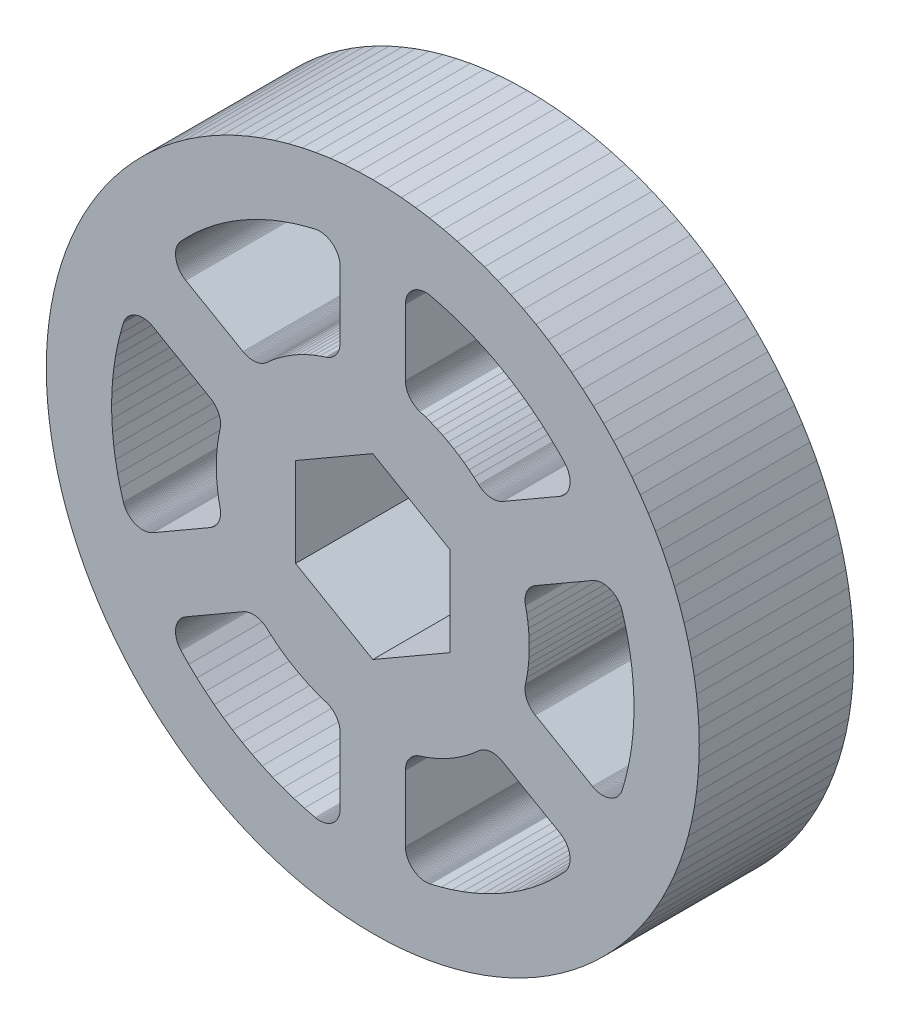
from build123d import *

# Parameters (mm, degrees)
BOSS_EXTRUDE1_DEPTH = 12.699999847


with BuildPart() as part:
    # Sketch1 → Boss-Extrude1 (new body)
    with BuildSketch(Plane.XY.offset(12.699999847)):
        Polygon((19.795958769, 18.139653828), (18.985877629, 18.985877629), (18.139653828, 19.795958769), (17.258901935, 20.568357503), (16.345295583, 21.301604971), (15.400575355, 21.994301224), (14.426539916, 22.645130983), (13.425042081, 23.252855756), (12.39798881, 23.816315812), (11.347336288, 24.334440024), (10.275082048, 24.8062439), (9.183269896, 25.230825646), (8.073976124, 25.607379948), (6.949313452, 25.935190096), (5.811422164, 26.213629952), (4.662468143, 26.44217183), (3.504639175, 26.620378615), (2.340139045, 26.747911642), (1.171184213, 26.824528726), (0, 26.850084163), (-1.171184213, 26.824528726), (-2.340139045, 26.747911642), (-3.504639175, 26.620378615), (-4.662468143, 26.44217183), (-5.811422164, 26.213629952), (-6.949313452, 25.935190096), (-8.073976124, 25.607379948), (-9.183269896, 25.230825646), (-10.275082048, 24.8062439), (-11.347336288, 24.334440024), (-12.39798881, 23.816315812), (-13.425042081, 23.252855756), (-14.426539916, 22.645130983), (-15.400575355, 21.994301224), (-16.345295583, 21.301604971), (-17.258901935, 20.568357503), (-18.139653828, 19.795958769), (-18.985877629, 18.985877629), (-19.795958769, 18.139653828), (-20.568357503, 17.258901935), (-21.301604971, 16.345295583), (-21.994301224, 15.400575355), (-22.645130983, 14.426539916), (-23.252855756, 13.425042081), (-23.816315812, 12.39798881), (-24.334440024, 11.347336288), (-24.8062439, 10.275082048), (-25.230825646, 9.183269896), (-25.607379948, 8.073976124), (-25.935190096, 6.949313452), (-26.213629952, 5.811422164), (-26.44217183, 4.662468143), (-26.620378615, 3.504639175), (-26.747911642, 2.340139045), (-26.824528726, 1.171184213), (-26.850084163, 0), (-26.824528726, -1.171184213), (-26.747911642, -2.340139045), (-26.620378615, -3.504639175), (-26.44217183, -4.662468143), (-26.213629952, -5.811422164), (-25.935190096, -6.949313452), (-25.607379948, -8.073976124), (-25.230825646, -9.183269896), (-24.8062439, -10.275082048), (-24.334440024, -11.347336288), (-23.816315812, -12.39798881), (-23.252855756, -13.425042081), (-22.645130983, -14.426539916), (-21.994301224, -15.400575355), (-21.301604971, -16.345295583), (-20.568357503, -17.258901935), (-19.795958769, -18.139653828), (-18.985877629, -18.985877629), (-18.139653828, -19.795958769), (-17.258901935, -20.568357503), (-16.345295583, -21.301604971), (-15.400575355, -21.994301224), (-14.426539916, -22.645130983), (-13.425042081, -23.252855756), (-12.39798881, -23.816315812), (-11.347336288, -24.334440024), (-10.275082048, -24.8062439), (-9.183269896, -25.230825646), (-8.073976124, -25.607379948), (-6.949313452, -25.935190096), (-5.811422164, -26.213629952), (-4.662468143, -26.44217183), (-3.504639175, -26.620378615), (-2.340139045, -26.747911642), (-1.171184213, -26.824528726), (0, -26.850084163), (1.171184213, -26.824528726), (2.340139045, -26.747911642), (3.504639175, -26.620378615), (4.662468143, -26.44217183), (5.811422164, -26.213629952), (6.949313452, -25.935190096), (8.073976124, -25.607379948), (9.183269896, -25.230825646), (10.275082048, -24.8062439), (11.347336288, -24.334440024), (12.39798881, -23.816315812), (13.425042081, -23.252855756), (14.426539916, -22.645130983), (15.400575355, -21.994301224), (16.345295583, -21.301604971), (17.258901935, -20.568357503), (18.139653828, -19.795958769), (18.985877629, -18.985877629), (19.795958769, -18.139653828), (20.568357503, -17.258901935), (21.301604971, -16.345295583), (21.994301224, -15.400575355), (22.645130983, -14.426539916), (23.252855756, -13.425042081), (23.816315812, -12.39798881), (24.334440024, -11.347336288), (24.8062439, -10.275082048), (25.230825646, -9.183269896), (25.607379948, -8.073976124), (25.935190096, -6.949313452), (26.213629952, -5.811422164), (26.44217183, -4.662468143), (26.620378615, -3.504639175), (26.747911642, -2.340139045), (26.824528726, -1.171184213), (26.850084163, 0), (26.824528726, 1.171184213), (26.747911642, 2.340139045), (26.620378615, 3.504639175), (26.44217183, 4.662468143), (26.213629952, 5.811422164), (25.935190096, 6.949313452), (25.607379948, 8.073976124), (25.230825646, 9.183269896), (24.8062439, 10.275082048), (24.334440024, 11.347336288), (23.816315812, 12.39798881), (23.252855756, 13.425042081), (22.645130983, 14.426539916), (21.994301224, 15.400575355), (21.301604971, 16.345295583), (20.568357503, 17.258901935), align=None)
        Polygon((13.769513346, 16.486170008), (14.466463588, 15.878121337), (15.136591353, 15.240634395), (15.778654213, 14.574888602), (15.826125419, 14.521243648), (15.871263381, 14.465621835), (15.913987368, 14.40812358), (15.954217638, 14.348855209), (15.991883307, 14.287924032), (16.026913491, 14.225440311), (16.059245184, 14.161518248), (16.088819315, 14.096275981), (16.115581738, 14.029829681), (16.139485198, 13.962302409), (16.160484406, 13.893816242), (16.178541953, 13.824497196), (16.193624366, 13.754469315), (16.205705064, 13.683862553), (16.214761404, 13.612803909), (16.220776648, 13.541424321), (16.223739968, 13.469852757), (16.223645495, 13.398219154), (16.220495128, 13.326655465), (16.214294804, 13.255291629), (16.205052402, 13.184256612), (16.192788594, 13.113681353), (16.177523071, 13.043693835), (16.159284383, 12.974422042), (16.138106002, 12.905991005), (16.114027309, 12.838525754), (16.087090636, 12.772150336), (16.057346193, 12.706984857), (16.024848126, 12.643147457), (15.989654521, 12.580756276), (15.951831339, 12.51992256), (15.911445524, 12.460759527), (15.868571898, 12.403373501), (15.823288237, 12.347869823), (15.775677237, 12.294348911), (15.725825533, 12.24290823), (15.673824684, 12.193642291), (15.619767232, 12.146640682), (15.563754579, 12.101988071), (15.505886159, 12.059767154), (15.446269281, 12.020054723), (15.38501224, 11.982921659), (10.675257208, 9.263743323), (10.613190542, 9.229635084), (10.549740051, 9.198176635), (10.48501858, 9.169421601), (10.419142301, 9.143424128), (10.352227383, 9.120229503), (10.28439295, 9.09987809), (10.215761078, 9.0824073), (10.146452861, 9.067847652), (10.076591359, 9.056225727), (10.006302588, 9.047561215), (9.935711577, 9.041870853), (9.864940405, 9.039163501), (9.794120009, 9.039445065), (9.723374433, 9.042713578), (9.652829694, 9.0489651), (9.582611806, 9.058186834), (9.5128458, 9.070363028), (9.443654737, 9.085473007), (9.375163648, 9.103488221), (9.30749264, 9.124377167), (9.240763791, 9.148102433), (9.175096224, 9.174622671), (9.110605125, 9.203889641), (9.047406663, 9.235852149), (8.985613071, 9.270452111), (8.925334612, 9.307629472), (8.86667761, 9.347316302), (8.809748392, 9.389442703), (8.75464639, 9.433933853), (8.701471038, 9.480710008), (8.317225887, 9.819532681), (7.919798884, 10.142792507), (7.509820596, 10.449977553), (7.087940787, 10.740603449), (6.654827435, 11.014206497), (6.211167716, 11.270353523), (5.757664064, 11.508638916), (5.295035651, 11.728685615), (4.824015922, 11.930144125), (4.345350631, 12.112695473), (3.85979882, 12.2760512), (3.792701771, 12.298714199), (3.726620717, 12.324187923), (3.661673306, 12.352427083), (3.597975215, 12.383381472), (3.535639906, 12.416995958), (3.474778382, 12.453210486), (3.415498935, 12.491961065), (3.3579074, 12.533177795), (3.302106163, 12.57678881), (3.248194904, 12.622714364), (3.196269118, 12.67087373), (3.146421841, 12.721182242), (3.09874143, 12.773548341), (3.053313044, 12.827879486), (3.010217411, 12.884079196), (2.969531321, 12.942047053), (2.931327382, 13.001679686), (2.895673522, 13.062871754), (2.862633487, 13.125512993), (2.832265855, 13.189493142), (2.804624527, 13.254697997), (2.77975922, 13.321010407), (2.757713743, 13.38831223), (2.738527968, 13.456484344), (2.722235368, 13.525406641), (2.708865478, 13.594955074), (2.69844168, 13.665004614), (2.690982925, 13.735432198), (2.686502503, 13.806110828), (2.685008044, 13.876916457), (2.685008044, 19.315273358), (2.68653696, 19.386889224), (2.691120753, 19.458375137), (2.698751057, 19.529601145), (2.709414333, 19.600435324), (2.723090645, 19.670751661), (2.739755629, 19.740420203), (2.759378272, 19.809312965), (2.781923379, 19.877305901), (2.807349354, 19.944272997), (2.83561042, 20.010096114), (2.86665489, 20.074653174), (2.900425909, 20.137826039), (2.936862194, 20.199500508), (2.975897291, 20.259562379), (3.017460316, 20.317905328), (3.061474973, 20.37442106), (3.107861761, 20.429005219), (3.156535525, 20.481561325), (3.20740815, 20.531990929), (3.260386357, 20.580207396), (3.315374158, 20.626116214), (3.372270888, 20.669636655), (3.430973176, 20.71068996), (3.491373959, 20.749199339), (3.553363218, 20.785097845), (3.616827985, 20.818316565), (3.681652581, 20.848798397), (3.747718867, 20.876484274), (3.814906736, 20.901324969), (3.883093371, 20.923277165), (3.952154727, 20.942299514), (4.021965035, 20.958356574), (4.092396804, 20.971418811), (4.163322049, 20.981464564), (4.234611556, 20.988474145), (4.30613488, 20.992433771), (4.377762068, 20.993339503), (4.449363166, 20.991187404), (4.520806746, 20.985979443), (4.591962855, 20.977729403), (4.662702523, 20.966449096), (4.732895799, 20.952160184), (5.630479547, 20.728989692), (6.517624238, 20.467386613), (7.392684293, 20.167833347), (8.254037762, 19.830889085), (9.1000878, 19.457176027), (9.929265126, 19.047389222), (10.740033441, 18.602282792), (11.530888442, 18.122691586), (12.30036422, 17.60949574), (13.047034248, 17.063652179), align=None, mode=Mode.SUBTRACT)
        Polygon((16.193624366, -13.754468214), (16.178541953, -13.824496095), (16.160484406, -13.893815142), (16.139485198, -13.962301308), (16.115581738, -14.02982858), (16.088819315, -14.09627488), (16.059245184, -14.161517147), (16.026913491, -14.22543921), (15.991883307, -14.287922931), (15.954217638, -14.348854108), (15.913987368, -14.408122479), (15.871263381, -14.465620734), (15.826125419, -14.521242547), (15.778654213, -14.574887501), (15.136591353, -15.240633294), (14.466463588, -15.878120236), (13.769513346, -16.486168907), (13.047034248, -17.063651078), (12.30036422, -17.609494639), (11.530888442, -18.122690486), (10.740033441, -18.602281691), (9.929265126, -19.047388121), (9.1000878, -19.457174926), (8.254037762, -19.830887985), (7.392684293, -20.167832246), (6.517624238, -20.467385512), (5.630479547, -20.728988592), (4.732895799, -20.952159083), (4.662702523, -20.966447996), (4.591962855, -20.977728302), (4.520806746, -20.985978342), (4.449363166, -20.991186304), (4.377762068, -20.993338403), (4.30613488, -20.99243267), (4.234611556, -20.988473045), (4.163322049, -20.981463463), (4.092396804, -20.97141771), (4.021965035, -20.958355474), (3.952154727, -20.942298414), (3.883093371, -20.923276065), (3.814906736, -20.901323868), (3.747718867, -20.876483173), (3.681652581, -20.848797297), (3.616827985, -20.818315464), (3.553363218, -20.785096744), (3.491373959, -20.749198238), (3.430973176, -20.710688859), (3.372270888, -20.669635554), (3.315374158, -20.626115113), (3.260386357, -20.580206295), (3.20740815, -20.531989828), (3.156535525, -20.481560224), (3.107861761, -20.429004118), (3.061474973, -20.374419959), (3.017460316, -20.317904227), (2.975897291, -20.259561278), (2.936862194, -20.199499407), (2.900425909, -20.137824939), (2.86665489, -20.074652074), (2.83561042, -20.010095013), (2.807349354, -19.944271896), (2.781923379, -19.8773048), (2.759378272, -19.809311864), (2.739755629, -19.740419102), (2.723090645, -19.670750561), (2.709414333, -19.600434224), (2.698751057, -19.529600044), (2.691120753, -19.458374037), (2.68653696, -19.386888124), (2.685008044, -19.315272257), (2.685008044, -13.876915357), (2.686502508, -13.806109727), (2.690982936, -13.735431098), (2.698441697, -13.665003514), (2.708865501, -13.594953975), (2.722235396, -13.525405543), (2.738528002, -13.456483247), (2.757713782, -13.388311135), (2.779759264, -13.321009313), (2.804624577, -13.254696906), (2.83226591, -13.189492053), (2.862633547, -13.125511907), (2.895673587, -13.06287067), (2.931327452, -13.001678605), (2.969531396, -12.942045975), (3.01021749, -12.884078121), (3.053313128, -12.827878415), (3.098741518, -12.773547274), (3.146421934, -12.721181178), (3.196269215, -12.67087267), (3.248195004, -12.622713308), (3.302106267, -12.576787758), (3.357907508, -12.533176748), (3.415499046, -12.491960022), (3.474778496, -12.453209448), (3.535640023, -12.416994925), (3.597975334, -12.383380445), (3.661673428, -12.352426061), (3.726620842, -12.324186905), (3.792701897, -12.298713187), (3.859798948, -12.276050193), (4.345350772, -12.112694505), (4.824016078, -11.930143196), (5.295035823, -11.728684723), (5.757664254, -11.508638061), (6.211167925, -11.270352705), (6.654827665, -11.014205714), (7.087941038, -10.7406027), (7.50982087, -10.449976839), (7.919799183, -10.142791826), (8.317226212, -9.819532031), (8.70147139, -9.48070939), (8.754646746, -9.433933239), (8.809748751, -9.389442093), (8.866677973, -9.347315697), (8.925334978, -9.307628871), (8.98561344, -9.270451515), (9.047407035, -9.235851558), (9.110605499, -9.203889055), (9.175096601, -9.17462209), (9.24076417, -9.148101857), (9.307493021, -9.124376596), (9.37516403, -9.103487656), (9.443655121, -9.085472448), (9.512846185, -9.070362474), (9.582612192, -9.058186286), (9.652830081, -9.048964558), (9.72337482, -9.042713041), (9.794120396, -9.039444534), (9.864940793, -9.039162975), (9.935711965, -9.041870333), (10.006302974, -9.047560701), (10.076591745, -9.056225218), (10.146453246, -9.067847149), (10.215761462, -9.082406802), (10.284393332, -9.099877598), (10.352227764, -9.120229016), (10.41914268, -9.143423647), (10.485018957, -9.169421125), (10.549740425, -9.198176164), (10.613190915, -9.229634618), (10.675257208, -9.263743323), (15.38501224, -11.982921659), (15.446269281, -12.020054723), (15.505886159, -12.059767154), (15.563754579, -12.101988071), (15.619767232, -12.146640682), (15.673824684, -12.193642291), (15.725825533, -12.24290823), (15.775677237, -12.294348911), (15.823288237, -12.347869823), (15.868571898, -12.403373501), (15.911445524, -12.460759527), (15.951831339, -12.51992256), (15.989654521, -12.580756276), (16.024848126, -12.643147457), (16.057346193, -12.706984857), (16.087090636, -12.772150336), (16.114027309, -12.838525754), (16.138106002, -12.905991005), (16.159284383, -12.974422042), (16.177523071, -13.043693835), (16.192788594, -13.113681353), (16.205052402, -13.184256612), (16.214294804, -13.255291629), (16.220495128, -13.326655465), (16.223645495, -13.398219154), (16.223740001, -13.469852741), (16.220776648, -13.54142322), (16.214761404, -13.612802808), (16.205705064, -13.683861452), align=None, mode=Mode.SUBTRACT)
        Polygon((21.162199959, -3.681661617), (20.984089727, -4.589261846), (20.767072381, -5.488353361), (20.511551563, -6.377269173), (20.488829499, -6.44520255), (20.463228782, -6.512104671), (20.434796666, -6.577853461), (20.403582376, -6.642328811), (20.369646952, -6.705413075), (20.333049461, -6.766992051), (20.29385882, -6.826953014), (20.252143941, -6.885186688), (20.207981616, -6.941586745), (20.161452572, -6.9960508), (20.112641476, -7.048479911), (20.061636933, -7.09877809), (20.008533453, -7.146853778), (19.953425548, -7.192619357), (19.896415605, -7.235991145), (19.837606011, -7.276890874), (19.777105059, -7.315243231), (19.715023014, -7.350978808), (19.651472107, -7.384032139), (19.586566539, -7.414343167), (19.520428387, -7.441857255), (19.45317579, -7.466523208), (19.384932794, -7.488296725), (19.315821477, -7.507137933), (19.245967852, -7.523012868), (19.175503843, -7.535891994), (19.104553494, -7.545752669), (19.033246759, -7.552575695), (18.961711621, -7.556349749), (18.890081972, -7.55706745), (18.818487765, -7.554727811), (18.747058952, -7.549334771), (18.675923517, -7.540898175), (18.605213383, -7.529433282), (18.535058501, -7.514961752), (18.465582919, -7.497508688), (18.396916588, -7.477107071), (18.329183556, -7.45379382), (18.262507867, -7.427610776), (18.19700963, -7.398606178), (18.132808953, -7.366832698), (18.070022006, -7.332348419), (13.360266544, -4.613170337), (13.299694357, -4.576477548), (13.240725271, -4.537257367), (13.18346231, -4.495584324), (13.128008845, -4.451531765), (13.074464309, -4.405179926), (13.022922229, -4.356609042), (12.973476132, -4.305907226), (12.926213638, -4.253164067), (12.881217444, -4.198474075), (12.838569262, -4.14193373), (12.798344899, -4.083644683), (12.760616223, -4.023710057), (12.725449194, -3.962237163), (12.692907805, -3.899335033), (12.663049155, -3.8351159), (12.635926408, -3.769694209), (12.611587804, -3.703186379), (12.590077644, -3.635711039), (12.571434324, -3.567388051), (12.555689348, -3.498339494), (12.54287225, -3.428687443), (12.53300469, -3.358557421), (12.526105372, -3.288072736), (12.52218611, -3.217360387), (12.521254781, -3.146545405), (12.523311384, -3.075754051), (12.528352966, -3.005112585), (12.536370667, -2.934746778), (12.547349719, -2.864781904), (12.561271416, -2.795342749), (12.662577584, -2.293164842), (12.743815872, -1.78735293), (12.804858297, -1.278708389), (12.845607394, -0.768037271), (12.865996217, -0.256148938), (12.865996217, 0.25614533), (12.845607435, 0.768033665), (12.804858379, 1.278704786), (12.743815994, 1.787349332), (12.662577747, 2.29316125), (12.561271619, 2.795339166), (12.547349928, 2.864778322), (12.536370881, 2.934743196), (12.528353186, 3.005109004), (12.52331161, 3.07575047), (12.521255012, 3.146541824), (12.522186347, 3.217356806), (12.526105614, 3.288069155), (12.533004938, 3.358553839), (12.542872504, 3.42868386), (12.555689608, 3.498335911), (12.571434589, 3.567384467), (12.590077915, 3.635707453), (12.61158808, 3.703182791), (12.635926689, 3.76969062), (12.663049442, 3.835112308), (12.692908096, 3.899331439), (12.725449491, 3.962233566), (12.760616525, 4.023706457), (12.798345206, 4.08364108), (12.838569573, 4.141930125), (12.88121776, 4.198470465), (12.926213958, 4.253160454), (12.973476457, 4.30590361), (13.022922558, 4.356605422), (13.074464641, 4.405176301), (13.128009181, 4.451528137), (13.18346265, 4.495580691), (13.240725614, 4.537253729), (13.299694703, 4.576473906), (13.360266544, 4.613170338), (18.070022006, 7.332348419), (18.132808953, 7.366832698), (18.19700963, 7.398606178), (18.262507867, 7.427610776), (18.329183556, 7.45379382), (18.396916588, 7.477107071), (18.465582919, 7.497508688), (18.535058501, 7.514961752), (18.605213383, 7.529433282), (18.675923517, 7.540898175), (18.747058952, 7.549334771), (18.818487765, 7.554727811), (18.890081972, 7.55706745), (18.961711621, 7.556349749), (19.033246759, 7.552575695), (19.104553494, 7.545752669), (19.175503843, 7.535891994), (19.245967852, 7.523012868), (19.315821477, 7.507137933), (19.384932794, 7.488296725), (19.45317579, 7.466523208), (19.520428387, 7.441857255), (19.586566539, 7.414343167), (19.651472107, 7.384032139), (19.715023014, 7.350978808), (19.777105059, 7.315243231), (19.837606011, 7.276890874), (19.896415605, 7.235991145), (19.953425548, 7.192619357), (20.008533453, 7.146853778), (20.061636933, 7.09877809), (20.112641476, 7.048479911), (20.161452572, 6.9960508), (20.207981616, 6.941586745), (20.252143941, 6.885186688), (20.29385882, 6.826953014), (20.333049461, 6.766992051), (20.369646952, 6.705413075), (20.403582376, 6.642328811), (20.434796666, 6.577853461), (20.463228782, 6.512104671), (20.488829499, 6.44520255), (20.511551563, 6.377269173), (20.767072381, 5.488353361), (20.984089727, 4.589261846), (21.162199959, 3.681661617), (21.301074257, 2.767234927), (21.400452716, 1.847677807), (21.460156159, 0.924694905), (21.480068414, -2.486e-06), (21.460156159, -0.924694905), (21.400452716, -1.847677807), (21.301074257, -2.767234927), align=None, mode=Mode.SUBTRACT)
        Polygon((-2.685008465, -13.876915907), (-2.685008465, -19.315272808), (-2.686537381, -19.386888674), (-2.691121175, -19.458374587), (-2.698751478, -19.529600594), (-2.709414754, -19.600434774), (-2.723091067, -19.670751111), (-2.73975605, -19.740419652), (-2.759378693, -19.809312414), (-2.7819238, -19.877305351), (-2.807349775, -19.944272447), (-2.835610841, -20.010095564), (-2.866655311, -20.074652624), (-2.90042633, -20.137825489), (-2.936862615, -20.199499958), (-2.975897712, -20.259561829), (-3.017460738, -20.317904777), (-3.061475394, -20.374420509), (-3.107862183, -20.429004668), (-3.156535946, -20.481560775), (-3.207408571, -20.531990379), (-3.260386778, -20.580206846), (-3.315374579, -20.626115664), (-3.372271309, -20.669636105), (-3.430973597, -20.71068941), (-3.49137438, -20.749198788), (-3.55336364, -20.785097294), (-3.616828406, -20.818316014), (-3.681653002, -20.848797847), (-3.747719289, -20.876483723), (-3.814907157, -20.901324418), (-3.883093792, -20.923276615), (-3.952155148, -20.942298964), (-4.021965457, -20.958356024), (-4.092397225, -20.97141826), (-4.16332247, -20.981464014), (-4.234611977, -20.988473595), (-4.306135301, -20.992433221), (-4.377762489, -20.993338953), (-4.449363587, -20.991186854), (-4.520807167, -20.985978893), (-4.591963276, -20.977728852), (-4.662702944, -20.966448546), (-4.73289622, -20.952159633), (-5.630479969, -20.728989142), (-6.51762466, -20.467386063), (-7.392684715, -20.167832797), (-8.254038184, -19.830888535), (-9.100088221, -19.457175476), (-9.929265547, -19.047388672), (-10.740033862, -18.602282242), (-11.530888863, -18.122691036), (-12.300364642, -17.60949519), (-13.04703467, -17.063651629), (-13.769513767, -16.486169457), (-14.466464009, -15.878120787), (-15.136591774, -15.240633844), (-15.778654634, -14.574888052), (-15.826125841, -14.521243098), (-15.871263802, -14.465621284), (-15.913987789, -14.40812303), (-15.954218059, -14.348854659), (-15.991883728, -14.287923481), (-16.026913912, -14.225439761), (-16.059245605, -14.161517697), (-16.088819737, -14.096275431), (-16.11558216, -14.029829131), (-16.139485619, -13.962301859), (-16.160484827, -13.893815692), (-16.178542374, -13.824496645), (-16.193624788, -13.754468764), (-16.205705486, -13.683862002), (-16.214761825, -13.612803359), (-16.220777069, -13.541423771), (-16.22374039, -13.469852207), (-16.223645878, -13.39821862), (-16.220495505, -13.326654932), (-16.214295176, -13.255291096), (-16.205052768, -13.18425608), (-16.192788954, -13.113680821), (-16.177523425, -13.043693305), (-16.159284732, -12.974421513), (-16.138106346, -12.905990478), (-16.114027647, -12.838525229), (-16.087090969, -12.772149813), (-16.057346521, -12.706984336), (-16.024848449, -12.643146939), (-15.989654839, -12.580755761), (-15.951831651, -12.519922048), (-15.911445831, -12.460759018), (-15.868572201, -12.403372995), (-15.823288535, -12.347869321), (-15.775677531, -12.294348413), (-15.725825824, -12.242907736), (-15.673824971, -12.193641801), (-15.619767515, -12.146640197), (-15.563754858, -12.10198759), (-15.505886434, -12.059766678), (-15.446269554, -12.020054251), (-15.385012509, -11.982921192), (-10.67525726, -9.263743234), (-10.613190964, -9.229634533), (-10.549740472, -9.198176085), (-10.485019001, -9.169421051), (-10.419142722, -9.143423578), (-10.352227804, -9.120228953), (-10.284393371, -9.09987754), (-10.215761499, -9.082406749), (-10.146453282, -9.067847101), (-10.07659178, -9.056225177), (-10.006303009, -9.047560665), (-9.935711999, -9.041870303), (-9.864940826, -9.03916295), (-9.79412043, -9.039444515), (-9.723374854, -9.042713028), (-9.652830115, -9.04896455), (-9.582612228, -9.058186284), (-9.512846221, -9.070362478), (-9.443655159, -9.085472457), (-9.375164069, -9.103487671), (-9.307493062, -9.124376616), (-9.240764212, -9.148101882), (-9.175096645, -9.17462212), (-9.110605546, -9.20388909), (-9.047407084, -9.235851599), (-8.985613492, -9.27045156), (-8.925335033, -9.307628921), (-8.866678031, -9.347315752), (-8.809748813, -9.389442153), (-8.754646811, -9.433933303), (-8.701471459, -9.480709458), (-8.317226308, -9.81953213), (-7.919799305, -10.142791957), (-7.509821017, -10.449977003), (-7.087941208, -10.740602898), (-6.654827857, -11.014205947), (-6.211168137, -11.270352973), (-5.757664486, -11.508638365), (-5.295036072, -11.728685064), (-4.824016344, -11.930143575), (-4.345351052, -12.112694922), (-3.859799241, -12.27605065), (-3.792702192, -12.298713649), (-3.726621139, -12.324187372), (-3.661673727, -12.352426533), (-3.597975636, -12.383380922), (-3.535640327, -12.416995407), (-3.474778803, -12.453209935), (-3.415499356, -12.491960514), (-3.357907821, -12.533177245), (-3.302106584, -12.576788259), (-3.248195325, -12.622713814), (-3.196269539, -12.67087318), (-3.146422262, -12.721181692), (-3.098741851, -12.773547791), (-3.053313465, -12.827878936), (-3.010217832, -12.884078646), (-2.969531743, -12.942046503), (-2.931327803, -13.001679136), (-2.895673943, -13.062871203), (-2.862633908, -13.125512443), (-2.832266276, -13.189492591), (-2.804624948, -13.254697447), (-2.779759641, -13.321009856), (-2.757714164, -13.38831168), (-2.738528389, -13.456483794), (-2.722235789, -13.52540609), (-2.7088659, -13.594954524), (-2.698442101, -13.665004063), (-2.690983346, -13.735431648), (-2.686502924, -13.806110278), align=None, mode=Mode.SUBTRACT)
        Polygon((-2.685008465, 13.876915907), (-2.686502924, 13.806110278), (-2.690983346, 13.735431648), (-2.698442101, 13.665004063), (-2.7088659, 13.594954524), (-2.722235789, 13.52540609), (-2.738528389, 13.456483794), (-2.757714164, 13.38831168), (-2.779759641, 13.321009856), (-2.804624948, 13.254697447), (-2.832266276, 13.189492591), (-2.862633908, 13.125512443), (-2.895673943, 13.062871203), (-2.931327803, 13.001679136), (-2.969531743, 12.942046503), (-3.010217832, 12.884078646), (-3.053313465, 12.827878936), (-3.098741851, 12.773547791), (-3.146422262, 12.721181692), (-3.196269539, 12.67087318), (-3.248195325, 12.622713814), (-3.302106584, 12.576788259), (-3.357907821, 12.533177245), (-3.415499356, 12.491960514), (-3.474778803, 12.453209935), (-3.535640327, 12.416995407), (-3.597975636, 12.383380922), (-3.661673727, 12.352426533), (-3.726621139, 12.324187372), (-3.792702192, 12.298713649), (-3.859799241, 12.27605065), (-4.345351052, 12.112694922), (-4.824016344, 11.930143575), (-5.295036072, 11.728685064), (-5.757664486, 11.508638365), (-6.211168137, 11.270352973), (-6.654827857, 11.014205947), (-7.087941208, 10.740602898), (-7.509821017, 10.449977003), (-7.919799305, 10.142791957), (-8.317226308, 9.81953213), (-8.701471459, 9.480709458), (-8.754646811, 9.433933303), (-8.809748813, 9.389442153), (-8.866678031, 9.347315752), (-8.925335033, 9.307628921), (-8.985613492, 9.27045156), (-9.047407084, 9.235851599), (-9.110605546, 9.20388909), (-9.175096645, 9.17462212), (-9.240764212, 9.148101882), (-9.307493062, 9.124376616), (-9.375164069, 9.103487671), (-9.443655159, 9.085472457), (-9.512846221, 9.070362478), (-9.582612228, 9.058186284), (-9.652830115, 9.04896455), (-9.723374854, 9.042713028), (-9.79412043, 9.039444515), (-9.864940826, 9.03916295), (-9.935711999, 9.041870303), (-10.006303009, 9.047560665), (-10.07659178, 9.056225177), (-10.146453282, 9.067847101), (-10.215761499, 9.082406749), (-10.284393371, 9.09987754), (-10.352227804, 9.120228953), (-10.419142722, 9.143423578), (-10.485019001, 9.169421051), (-10.549740472, 9.198176085), (-10.613190964, 9.229634533), (-10.67525726, 9.263743234), (-15.385012509, 11.982921192), (-15.446269554, 12.020054251), (-15.505886434, 12.059766678), (-15.563754858, 12.10198759), (-15.619767515, 12.146640197), (-15.673824971, 12.193641801), (-15.725825824, 12.242907736), (-15.775677531, 12.294348413), (-15.823288535, 12.347869321), (-15.868572201, 12.403372995), (-15.911445831, 12.460759018), (-15.951831651, 12.519922048), (-15.989654839, 12.580755761), (-16.024848449, 12.643146939), (-16.057346521, 12.706984336), (-16.087090969, 12.772149813), (-16.114027647, 12.838525229), (-16.138106346, 12.905990478), (-16.159284732, 12.974421513), (-16.177523425, 13.043693305), (-16.192788954, 13.113680821), (-16.205052768, 13.18425608), (-16.214295176, 13.255291096), (-16.220495505, 13.326654932), (-16.223645878, 13.39821862), (-16.22374039, 13.469852207), (-16.220777069, 13.541423771), (-16.214761825, 13.612803359), (-16.205705486, 13.683862002), (-16.193624788, 13.754468764), (-16.178542374, 13.824496645), (-16.160484827, 13.893815692), (-16.139485619, 13.962301859), (-16.11558216, 14.029829131), (-16.088819737, 14.096275431), (-16.059245605, 14.161517697), (-16.026913912, 14.225439761), (-15.991883728, 14.287923481), (-15.954218059, 14.348854659), (-15.913987789, 14.40812303), (-15.871263802, 14.465621284), (-15.826125841, 14.521243098), (-15.778654634, 14.574888052), (-15.136591774, 15.240633844), (-14.466464009, 15.878120787), (-13.769513767, 16.486169457), (-13.04703467, 17.063651629), (-12.300364642, 17.60949519), (-11.530888863, 18.122691036), (-10.740033862, 18.602282242), (-9.929265547, 19.047388672), (-9.100088221, 19.457175476), (-8.254038184, 19.830888535), (-7.392684715, 20.167832797), (-6.51762466, 20.467386063), (-5.630479969, 20.728989142), (-4.73289622, 20.952159633), (-4.662702944, 20.966448546), (-4.591963276, 20.977728852), (-4.520807167, 20.985978893), (-4.449363587, 20.991186854), (-4.377762489, 20.993338953), (-4.306135301, 20.992433221), (-4.234611977, 20.988473595), (-4.16332247, 20.981464014), (-4.092397225, 20.97141826), (-4.021965457, 20.958356024), (-3.952155148, 20.942298964), (-3.883093792, 20.923276615), (-3.814907157, 20.901324418), (-3.747719289, 20.876483723), (-3.681653002, 20.848797847), (-3.616828406, 20.818316014), (-3.55336364, 20.785097294), (-3.49137438, 20.749198788), (-3.430973597, 20.71068941), (-3.372271309, 20.669636105), (-3.315374579, 20.626115664), (-3.260386778, 20.580206846), (-3.207408571, 20.531990379), (-3.156535946, 20.481560775), (-3.107862183, 20.429004668), (-3.061475394, 20.374420509), (-3.017460738, 20.317904777), (-2.975897712, 20.259561829), (-2.936862615, 20.199499958), (-2.90042633, 20.137825489), (-2.866655311, 20.074652624), (-2.835610841, 20.010095564), (-2.807349775, 19.944272447), (-2.7819238, 19.877305351), (-2.759378693, 19.809312414), (-2.73975605, 19.740419652), (-2.723091067, 19.670751111), (-2.709414754, 19.600434774), (-2.698751478, 19.529600594), (-2.691121175, 19.458374587), (-2.686537381, 19.386888674), (-2.685008465, 19.315272808), align=None, mode=Mode.SUBTRACT)
        Polygon((-19.5204271, -7.441859584), (-19.586565255, -7.414345502), (-19.651470825, -7.384034478), (-19.715021735, -7.350981153), (-19.777103783, -7.31524558), (-19.837604737, -7.276893228), (-19.896414335, -7.235993504), (-19.953424282, -7.192621721), (-20.008532191, -7.146856146), (-20.061635674, -7.098780462), (-20.112640222, -7.048482287), (-20.161451321, -6.996053181), (-20.207980369, -6.941589129), (-20.252142699, -6.885189075), (-20.293857582, -6.826955405), (-20.333048229, -6.766994445), (-20.369645724, -6.705415472), (-20.403581154, -6.642331211), (-20.434795449, -6.577855863), (-20.46322757, -6.512107076), (-20.488828293, -6.445204956), (-20.511550362, -6.377271581), (-20.767071251, -5.48835579), (-20.984088669, -4.589264292), (-21.162198974, -3.681664078), (-21.301073345, -2.767237398), (-21.400451878, -1.847680286), (-21.460155394, -0.924697389), (-21.480067724, 0), (-21.460155394, 0.924697389), (-21.400451878, 1.847680286), (-21.301073345, 2.767237398), (-21.162198974, 3.681664078), (-20.984088669, 4.589264292), (-20.767071251, 5.48835579), (-20.511550362, 6.377271581), (-20.488828293, 6.445204956), (-20.46322757, 6.512107076), (-20.434795449, 6.577855863), (-20.403581154, 6.642331211), (-20.369645724, 6.705415472), (-20.333048229, 6.766994445), (-20.293857582, 6.826955405), (-20.252142699, 6.885189075), (-20.207980369, 6.941589129), (-20.161451321, 6.996053181), (-20.112640222, 7.048482287), (-20.061635674, 7.098780462), (-20.008532191, 7.146856146), (-19.953424282, 7.192621721), (-19.896414335, 7.235993504), (-19.837604737, 7.276893228), (-19.777103783, 7.31524558), (-19.715021735, 7.350981153), (-19.651470825, 7.384034478), (-19.586565255, 7.414345502), (-19.5204271, 7.441859584), (-19.453174502, 7.466525532), (-19.384931504, 7.488299043), (-19.315820185, 7.507140246), (-19.245966559, 7.523015175), (-19.175502549, 7.535894296), (-19.104552199, 7.545754965), (-19.033245463, 7.552577985), (-18.961710326, 7.556352034), (-18.890080677, 7.557069728), (-18.81848647, 7.554730084), (-18.747057657, 7.549337038), (-18.675922223, 7.540900436), (-18.605212089, 7.529435538), (-18.535057209, 7.514964002), (-18.465581628, 7.497510932), (-18.396915299, 7.47710931), (-18.329182268, 7.453796054), (-18.262506582, 7.427613004), (-18.197008347, 7.398608401), (-18.132807673, 7.366834915), (-18.070020729, 7.332350631), (-13.360265484, 4.613172173), (-13.299693646, 4.576475736), (-13.240724561, 4.537255555), (-13.1834616, 4.495582512), (-13.128008134, 4.451529953), (-13.074463598, 4.405178114), (-13.022921518, 4.35660723), (-12.973475422, 4.305905414), (-12.926212927, 4.253162255), (-12.881216733, 4.198472263), (-12.838568551, 4.141931918), (-12.798344189, 4.083642871), (-12.760615512, 4.023708245), (-12.725448483, 3.962235351), (-12.692907094, 3.899333221), (-12.663048444, 3.835114088), (-12.635925697, 3.769692397), (-12.611587093, 3.703184567), (-12.590076933, 3.635709227), (-12.571433613, 3.567386239), (-12.555688637, 3.498337682), (-12.542871539, 3.428685631), (-12.533003979, 3.358555609), (-12.526104661, 3.288070924), (-12.522185399, 3.217358575), (-12.52125407, 3.146543593), (-12.523310673, 3.075752255), (-12.528352255, 3.005110789), (-12.536369956, 2.934744982), (-12.547349008, 2.864780108), (-12.561270705, 2.795340953), (-12.662576873, 2.293163046), (-12.743815161, 1.787351134), (-12.804857586, 1.278706593), (-12.845606683, 0.768035475), (-12.865995506, 0.256147142), (-12.865995506, -0.256147126), (-12.845606683, -0.768035459), (-12.804857586, -1.278706577), (-12.743815161, -1.787351118), (-12.662576873, -2.29316303), (-12.561270705, -2.795340937), (-12.547349008, -2.864780092), (-12.536369956, -2.934744966), (-12.528352255, -3.005110773), (-12.523310673, -3.075752239), (-12.52125407, -3.146543593), (-12.522185399, -3.217358575), (-12.526104661, -3.288070924), (-12.533003979, -3.358555609), (-12.542871539, -3.428685631), (-12.555688637, -3.498337682), (-12.571433613, -3.567386239), (-12.590076933, -3.635709227), (-12.611587093, -3.703184567), (-12.635925697, -3.769692397), (-12.663048444, -3.835114088), (-12.692907094, -3.899333221), (-12.725448483, -3.962235351), (-12.760615512, -4.023708245), (-12.798344189, -4.083642871), (-12.838568551, -4.141931918), (-12.881216733, -4.198472263), (-12.926212927, -4.253162255), (-12.973475422, -4.305905414), (-13.022921518, -4.35660723), (-13.074463598, -4.405178114), (-13.128008134, -4.451529953), (-13.1834616, -4.495582512), (-13.240724561, -4.537255555), (-13.299693646, -4.576475736), (-13.360265484, -4.613172173), (-18.070020729, -7.332350631), (-18.132807673, -7.366834915), (-18.197008347, -7.398608401), (-18.262506582, -7.427613004), (-18.329182268, -7.453796054), (-18.396915299, -7.47710931), (-18.465581628, -7.497510932), (-18.535057209, -7.514964002), (-18.605212089, -7.529435538), (-18.675922223, -7.540900436), (-18.747057657, -7.549337038), (-18.81848647, -7.554730084), (-18.890080677, -7.557069728), (-18.961710326, -7.556352034), (-19.033245463, -7.552577985), (-19.104552199, -7.545754965), (-19.175502549, -7.535894296), (-19.245966559, -7.523015175), (-19.315820185, -7.507140246), (-19.384931504, -7.488299043), (-19.453174502, -7.466525532), align=None, mode=Mode.SUBTRACT)
        Polygon((0, 7.332348419), (-6.35, 3.666174209), (-6.35, -3.666174209), (0, -7.332348419), (6.35, -3.666174209), (6.35, 3.666174209), align=None, mode=Mode.SUBTRACT)
    extrude(amount=-BOSS_EXTRUDE1_DEPTH)


solid = part.part
